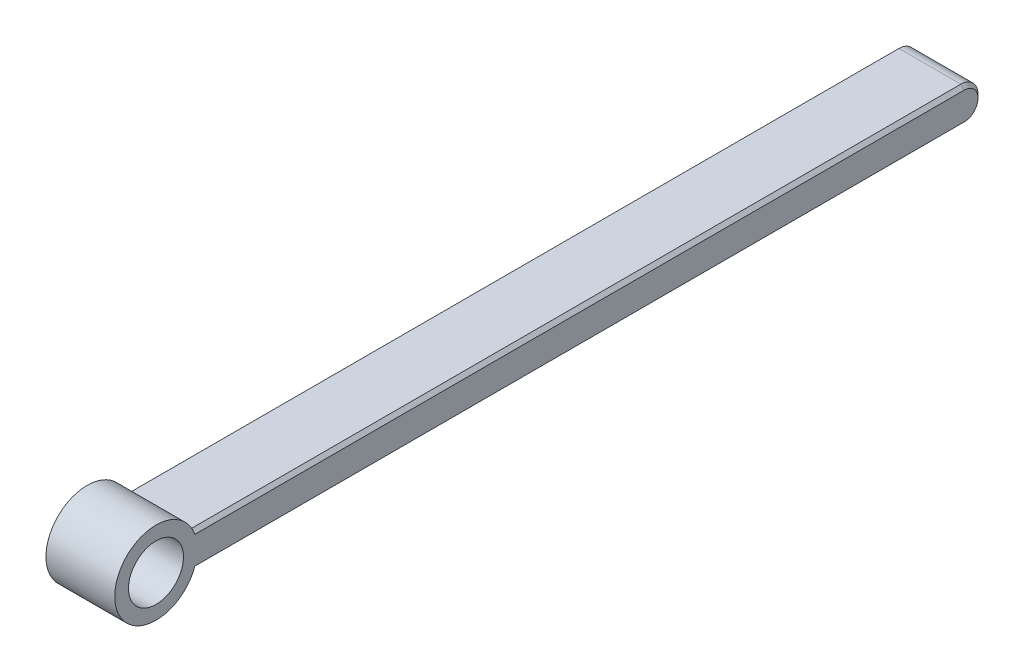
from build123d import *

# Parameters (mm, degrees)
SKETCH1_R           = 4
BOSS_EXTRUDE1_DEPTH = 5
CHAMFER1_SIZE       = 0.5


with BuildPart() as part:
    # Sketch1 → Boss-Extrude1 (new, symmetric)
    with BuildSketch(Plane(origin=(0, 0, 0), x_dir=(0, 0, -1), z_dir=(1, 0, 0))):
        with BuildLine():
            ThreePointArc((25.027203864, 27.270591385), (13.572847807, 24.770591385), (25.027203864, 22.270591385))
            Line((25.027203864, 22.270591385), (137.072847807, 22.270591385))
            ThreePointArc((137.072847807, 22.270591385), (139.572847807, 24.770591385), (137.072847807, 27.270591385))
            Line((137.072847807, 27.270591385), (25.027203864, 27.270591385))
        make_face()
        with Locations((19.572847807, 24.770591385)):
            Circle(SKETCH1_R, mode=Mode.SUBTRACT)
    extrude(amount=BOSS_EXTRUDE1_DEPTH, both=True)

    # Chamfer1
    chamfer1_edges = [part.edges().sort_by_distance(p)[0] for p in [
        (-5, 27.270591385, -81.050025835),
        (-5, 24.770591385, -139.572847807),
        (-5, 22.270591385, -81.050025835),
        (5, 27.270591385, -81.050025835),
        (5, 24.770591385, -139.572847807),
        (5, 22.270591385, -81.050025835),
    ]]
    chamfer(chamfer1_edges, length=CHAMFER1_SIZE)


solid = part.part
